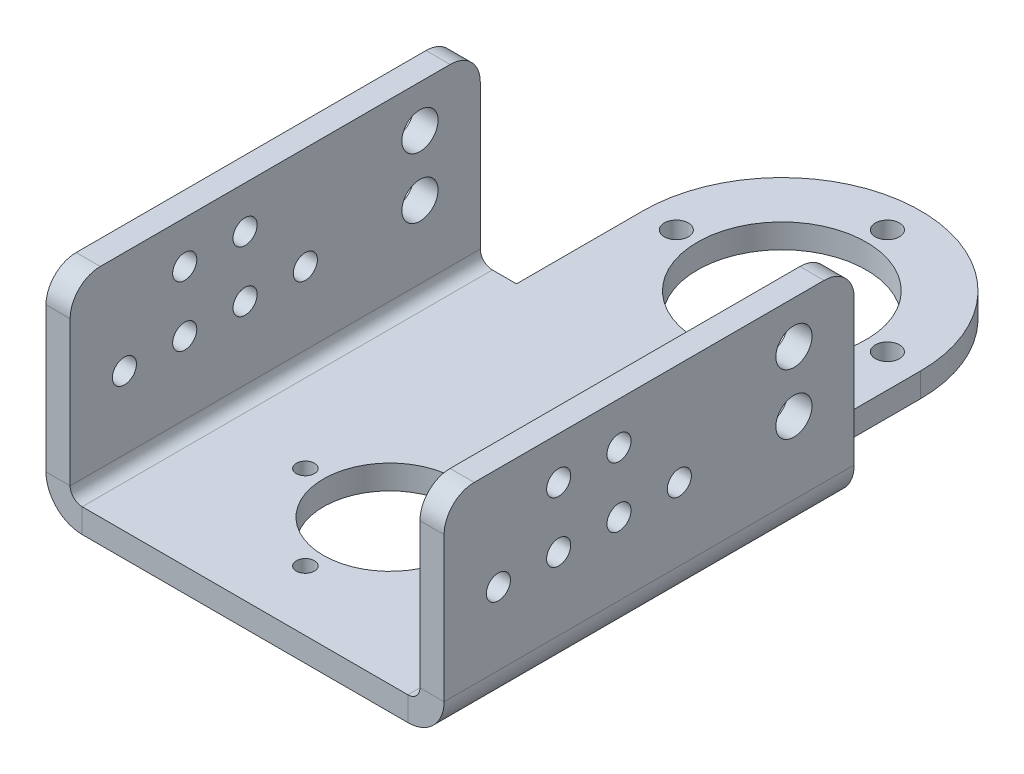
from build123d import *

# Parameters (mm, degrees)
SM_BASE_FLANGE_2_DEPTH      = 48
SM_BASE_FLANGE_2_DEPTH_BACK = 20
SKETCH_8_R                  = 11
SKETCH_8_R_2                = 1.5
CUT_EXTRUDE_1_DEPTH         = 66.984846745
SKETCH_10_R                 = 14
SKETCH_10_R_2               = 2
EXTRUDE_1_DEPTH             = 4
SKETCH_11_R                 = 2
CUT_EXTRUDE_2_DEPTH         = 99.371743911
FILLET_1_R                  = 5
SKETCH_13_R                 = 3
CUT_EXTRUDE_3_DEPTH         = 99.371743911


# Sheet-metal steps are written as plain solids
with BuildPart() as part:
    # Sketch 1 → 基体-法兰2 (new, two sides: drawn at the far end of the back side and taken through both)
    with BuildSketch(Plane.XY.offset(-SM_BASE_FLANGE_2_DEPTH_BACK)):
        with BuildLine():
            Line((-33, 35), (-33, 6))
            ThreePointArc((-33, 6), (-31.242640687, 1.757359313), (-27, 0))
            Line((-27, 0), (27, 0))
            ThreePointArc((27, 0), (31.242640687, 1.757359313), (33, 6))
            Line((33, 6), (33, 35))
            Line((33, 35), (29, 35))
            Line((29, 35), (29, 6))
            ThreePointArc((29, 6), (28.414213562, 4.585786438), (27, 4))
            Line((27, 4), (-27, 4))
            ThreePointArc((-27, 4), (-28.414213562, 4.585786438), (-29, 6))
            Line((-29, 6), (-29, 35))
            Line((-29, 35), (-33, 35))
        make_face()
    extrude(amount=SM_BASE_FLANGE_2_DEPTH + SM_BASE_FLANGE_2_DEPTH_BACK)

    # 草图8 → 切除-拉伸1 (cut, through all)
    with BuildSketch(Plane(origin=(0, 4, 0), x_dir=(1, 0, 0), z_dir=(0, 1, 0))):
        with Locations(Location((0, -24, 0), (0, 0, 270))):
            Circle(SKETCH_8_R)
        with Locations(Location((0, -10, 0), (0, 0, 270))):
            Circle(SKETCH_8_R_2)
        with Locations(Location((14, -24, 0), (0, 0, 270))):
            Circle(SKETCH_8_R_2)
        with Locations(Location((0, -38, 0), (0, 0, 270))):
            Circle(SKETCH_8_R_2)
        with Locations(Location((-14, -24, 0), (0, 0, 270))):
            Circle(SKETCH_8_R_2)
    extrude(amount=-CUT_EXTRUDE_1_DEPTH, mode=Mode.SUBTRACT)

    # 草图10 → 凸台-拉伸1 (add)
    with BuildSketch(Plane(origin=(0, 4, 0), x_dir=(1, 0, 0), z_dir=(0, 1, 0))):
        with BuildLine():
            Line((-23, 41), (-23, 20))
            Line((-23, 20), (23, 20))
            Line((23, 20), (23, 41))
            ThreePointArc((23, 41), (0, 64), (-23, 41))
        make_face()
        with Locations(Location((0, 41, 0), (0, 0, 270))):
            Circle(SKETCH_10_R, mode=Mode.SUBTRACT)
        with Locations(Location((0, 58.5, 0), (0, 0, 270))):
            Circle(SKETCH_10_R_2, mode=Mode.SUBTRACT)
        with Locations(Location((17.5, 41, 0), (0, 0, 270))):
            Circle(SKETCH_10_R_2, mode=Mode.SUBTRACT)
        with Locations(Location((0, 23.5, 0), (0, 0, 270))):
            Circle(SKETCH_10_R_2, mode=Mode.SUBTRACT)
        with Locations(Location((-17.5, 41, 0), (0, 0, 270))):
            Circle(SKETCH_10_R_2, mode=Mode.SUBTRACT)
    extrude(amount=-EXTRUDE_1_DEPTH)

    # 草图11 → 切除-拉伸2 (cut, through all)
    with BuildSketch(Plane.ZY.offset(33)):
        with Locations((19, 18)):
            Circle(SKETCH_11_R)
        with Locations((9, 18)):
            Circle(SKETCH_11_R)
        with Locations(Location((29, 18, 0), (0, 0, 180))):
            Circle(SKETCH_11_R)
        with Locations(Location((39, 18, 0), (0, 0, 180))):
            Circle(SKETCH_11_R)
        with Locations((19, 28)):
            Circle(SKETCH_11_R)
        with Locations(Location((29, 28, 0), (0, 0, 180))):
            Circle(SKETCH_11_R)
    extrude(amount=-CUT_EXTRUDE_2_DEPTH, mode=Mode.SUBTRACT)

    # 圆角1
    fillet_1_edges = [part.edges().sort_by_distance(p)[0] for p in [
        (-31, 35, -20),
        (31, 35, -20),
        (-31, 35, 48),
        (31, 35, 48),
    ]]
    fillet(fillet_1_edges, radius=FILLET_1_R)

    # 草图13 → 切除-拉伸3 (cut, through all)
    with BuildSketch(Plane(origin=(33, 0, 0), x_dir=(0, 0, -1), z_dir=(1, 0, 0))):
        with Locations((10, 28)):
            Circle(SKETCH_13_R)
        with Locations((10, 18)):
            Circle(SKETCH_13_R)
    extrude(amount=-CUT_EXTRUDE_3_DEPTH, mode=Mode.SUBTRACT)


solid = part.part
